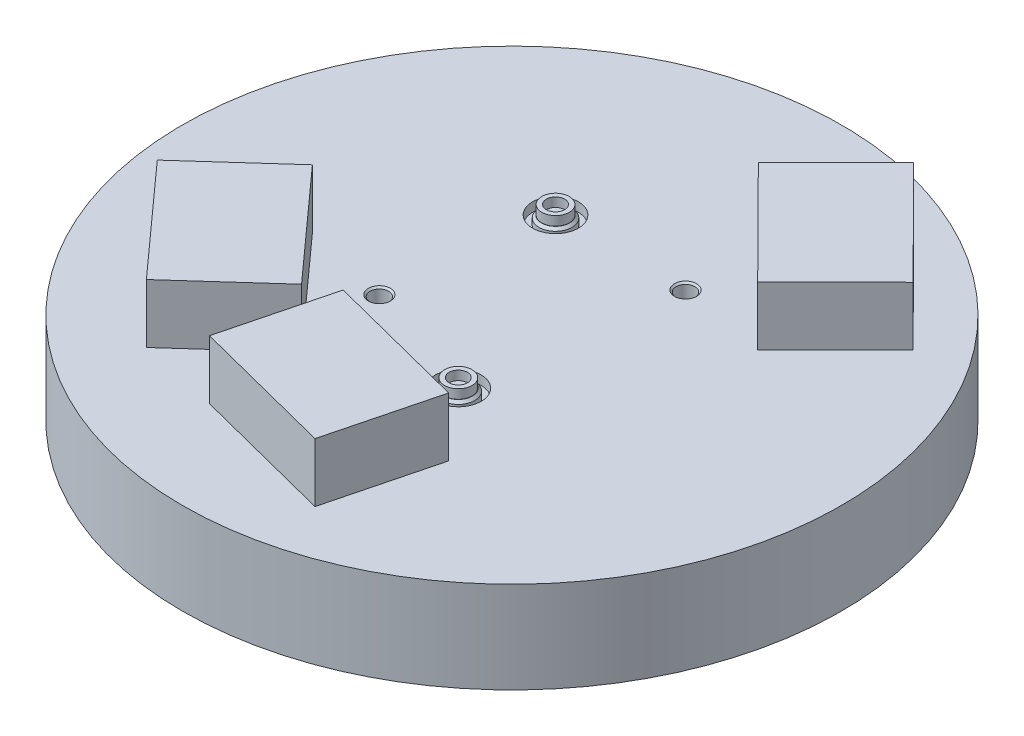
from build123d import *

# Parameters (mm, degrees)
SKETCH1_R                    = 180
BOSS_EXTRUDE1_DEPTH          = 50
BOSS_EXTRUDE2_DEPTH          = 32.148542
SKETCH3_R                    = 12.5
CUT_EXTRUDE1_DEPTH           = 5
M12_TAPPED_HOLE1_D           = 10.2
M12_TAPPED_HOLE1_DEPTH       = 17.5
M12_TAPPED_HOLE1_CSINK_D     = 12.05
M12_TAPPED_HOLE1_CSINK_ANGLE = 90
M12_TAPPED_HOLE1_TIP         = 3.064389157
SKETCH8_R                    = 10
BOSS_EXTRUDE3_DEPTH          = 5
SKETCH9_R                    = 7.5
SKETCH9_R_2                  = 5
BOSS_EXTRUDE4_DEPTH          = 5


# Read off the part's stored shape, not the designer's step: M18 Machine Threads Stud1, M18 Machine Threads Stud2
with BuildPart() as part:
    # Sketch1 → Boss-Extrude1 (new body)
    with BuildSketch(Plane(origin=(0, 0, 0), x_dir=(1, 0, 0), z_dir=(0, 1, 0))):
        with Locations(Location((0, 0, 0), (0, 0, 270))):
            Circle(SKETCH1_R)
    extrude(amount=BOSS_EXTRUDE1_DEPTH)

    # Sketch2 → Boss-Extrude2 (add)
    with BuildSketch(Plane(origin=(0, 50, 0), x_dir=(1, 0, 0), z_dir=(0, 1, 0))):
        Polygon((-84.548207039, -115.101573323), (-39.951504434, -74.962638151), (-93.470084664, -15.500368011), (-138.066787269, -55.639303183), align=None)
        Polygon((-40.744531967, -124.452472721), (36.749910483, -144.317300669), (51.648531443, -86.196468831), (-25.845911006, -66.331640884), align=None)
        Polygon((126.114531486, 92.960164639), (69.721759674, 149.703933348), (27.163933142, 107.409354489), (83.556704954, 50.66558578), align=None)
    extrude(amount=BOSS_EXTRUDE2_DEPTH)

    # Sketch3 → Cut-Extrude1 (cut)
    with BuildSketch(Plane(origin=(0, 50, 0), x_dir=(1, 0, 0), z_dir=(0, 1, 0))):
        with Locations(Location((-35.5, 59.3, 0), (0, 0, 270))):
            Circle(SKETCH3_R)
        with Locations(Location((19.854, -49.141, 0), (0, 0, 270))):
            Circle(SKETCH3_R)
    extrude(amount=-CUT_EXTRUDE1_DEPTH, mode=Mode.SUBTRACT)

    # M12 Tapped Hole1
    with Locations(Plane(origin=(0, 50, 0), x_dir=(1, 0, 0), z_dir=(0, 1, 0))):
        with Locations((35.5, 59.3), (-45.899, -26.5)):
            CounterSinkHole(M12_TAPPED_HOLE1_D / 2, M12_TAPPED_HOLE1_CSINK_D / 2, depth=M12_TAPPED_HOLE1_DEPTH, counter_sink_angle=M12_TAPPED_HOLE1_CSINK_ANGLE)
            with Locations((0, 0, -(M12_TAPPED_HOLE1_DEPTH + M12_TAPPED_HOLE1_TIP / 2))):  # 118° drill point
                Cone(0, M12_TAPPED_HOLE1_D / 2, M12_TAPPED_HOLE1_TIP, mode=Mode.SUBTRACT)

    # Sketch8 → Boss-Extrude3 (add)
    with BuildSketch(Plane(origin=(0, 45, 0), x_dir=(1, 0, 0), z_dir=(0, 1, 0))):
        with Locations(Location((-35.5, 59.3, 0), (0, 0, 270))):
            Circle(SKETCH8_R)
        with Locations(Location((19.854, -49.141, 0), (0, 0, 270))):
            Circle(SKETCH8_R)
    extrude(amount=BOSS_EXTRUDE3_DEPTH)

    # Sketch9 → Boss-Extrude4 (add)
    # profile 1 of 2: a face of its own
    with BuildSketch(Plane(origin=(0, 50, 0), x_dir=(1, 0, 0), z_dir=(0, 1, 0))):
        with Locations(Location((-35.5, 59.3, 0), (0, 0, 270))):
            Circle(SKETCH9_R)
        with Locations(Location((-35.5, 59.3, 0), (0, 0, 270))):
            Circle(SKETCH9_R_2, mode=Mode.SUBTRACT)
    # profile 2 of 2: a face of its own
    with BuildSketch(Plane(origin=(0, 50, 0), x_dir=(1, 0, 0), z_dir=(0, 1, 0))):
        with Locations(Location((19.854, -49.141, 0), (0, 0, 270))):
            Circle(SKETCH9_R)
        with Locations(Location((19.854, -49.141, 0), (0, 0, 270))):
            Circle(SKETCH9_R_2, mode=Mode.SUBTRACT)
    extrude(amount=BOSS_EXTRUDE4_DEPTH)

    # M18 Machine Threads Stud1 outline → M18 Machine Threads Stud1 (revolve, cut)
    with BuildSketch(Plane(origin=(-35.5, 0, -59.3), x_dir=(1, 0, 0), z_dir=(0, 0, 1))):
        Polygon((9, 48.626), (9, 45), (10, 45), (10, 50), (7.626, 50), align=None)
    revolve(axis=Axis((-35.5, 0, -59.3), (0, 1, 0)), mode=Mode.SUBTRACT)

    # M18 Machine Threads Stud2 outline → M18 Machine Threads Stud2 (revolve, cut)
    with BuildSketch(Plane(origin=(19.854, 0, 49.141), x_dir=(1, 0, 0), z_dir=(0, 0, 1))):
        Polygon((9, 48.626), (9, 45), (10, 45), (10, 50), (7.626, 50), align=None)
    revolve(axis=Axis((19.854, 0, 49.141), (0, 1, 0)), mode=Mode.SUBTRACT)


solid = part.part
